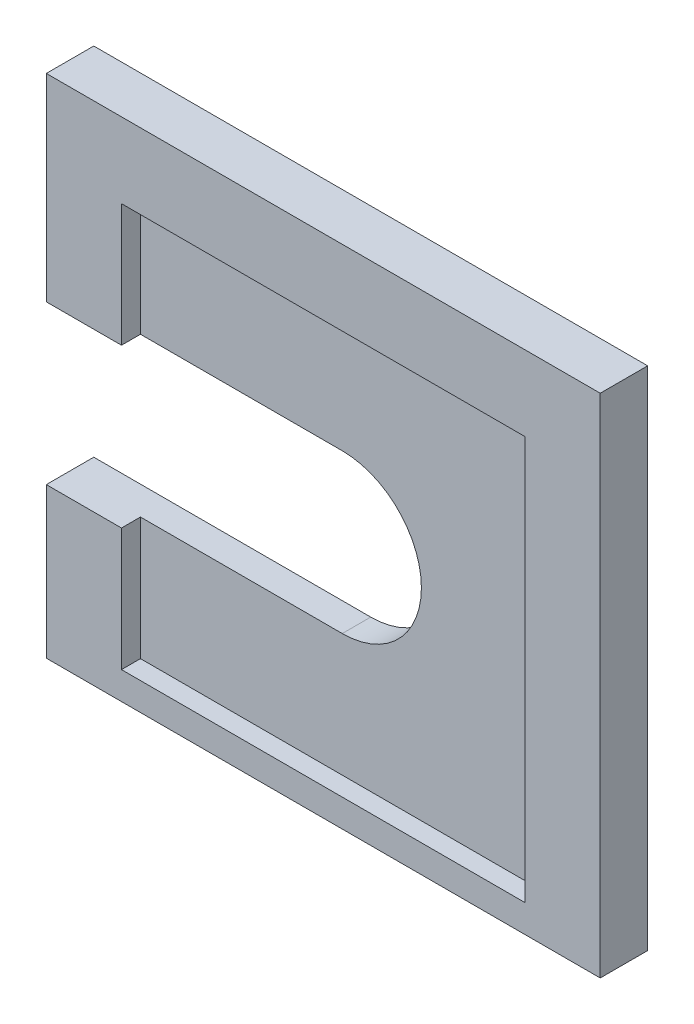
from build123d import *

# Parameters (mm, degrees)
SKETCH1_W           = 35
SKETCH1_H           = 35
BOSS_EXTRUDE1_DEPTH = 3
SKETCH2_W           = 25.5
SKETCH2_H           = 25.5
CUT_EXTRUDE1_DEPTH  = 1.2
SKETCH3_W           = 35
SKETCH3_H           = 3
CUT_EXTRUDE2_DEPTH  = 3
CUT_EXTRUDE3_REACH  = 51.588


with BuildPart() as part:
    # Sketch1 → Boss-Extrude1 (new body)
    with BuildSketch(Plane.XY):
        with Locations((17.5, 17.5)):
            Rectangle(SKETCH1_W, SKETCH1_H)
    extrude(amount=BOSS_EXTRUDE1_DEPTH)

    # Sketch2 → Cut-Extrude1 (cut)
    with BuildSketch(Plane.XY.offset(3)):
        with Locations((17.5, 17.5)):
            Rectangle(SKETCH2_W, SKETCH2_H)
    extrude(amount=-CUT_EXTRUDE1_DEPTH, mode=Mode.SUBTRACT)

    # Sketch3 → Cut-Extrude2 (cut)
    with BuildSketch(Plane.XZ):
        with Locations((17.5, 1.5)):
            Rectangle(SKETCH3_W, SKETCH3_H)
    extrude(amount=-CUT_EXTRUDE2_DEPTH, mode=Mode.SUBTRACT)

    # Sketch5 → Cut-Extrude3 (cut, up to next)
    with BuildSketch(Plane(origin=(0, 0, 0), x_dir=(-1, 0, 0), z_dir=(0, 0, -1)), mode=Mode.PRIVATE) as cut_extrude3_sk1:
        with BuildLine():
            Line((-17.5, 12.5), (0, 12.5))
            Line((0, 12.5), (0, 22.5))
            Line((0, 22.5), (-17.5, 22.5))
            ThreePointArc((-17.5, 22.5), (-22.5, 17.5), (-17.5, 12.5))
        make_face()
    cut_extrude3_tool1 = extrude(cut_extrude3_sk1.sketch, amount=-CUT_EXTRUDE3_REACH, mode=Mode.PRIVATE) & part.part
    add(cut_extrude3_tool1.solids().sort_by_distance((10.742557, 17.5, 0))[0], mode=Mode.SUBTRACT)


solid = part.part
